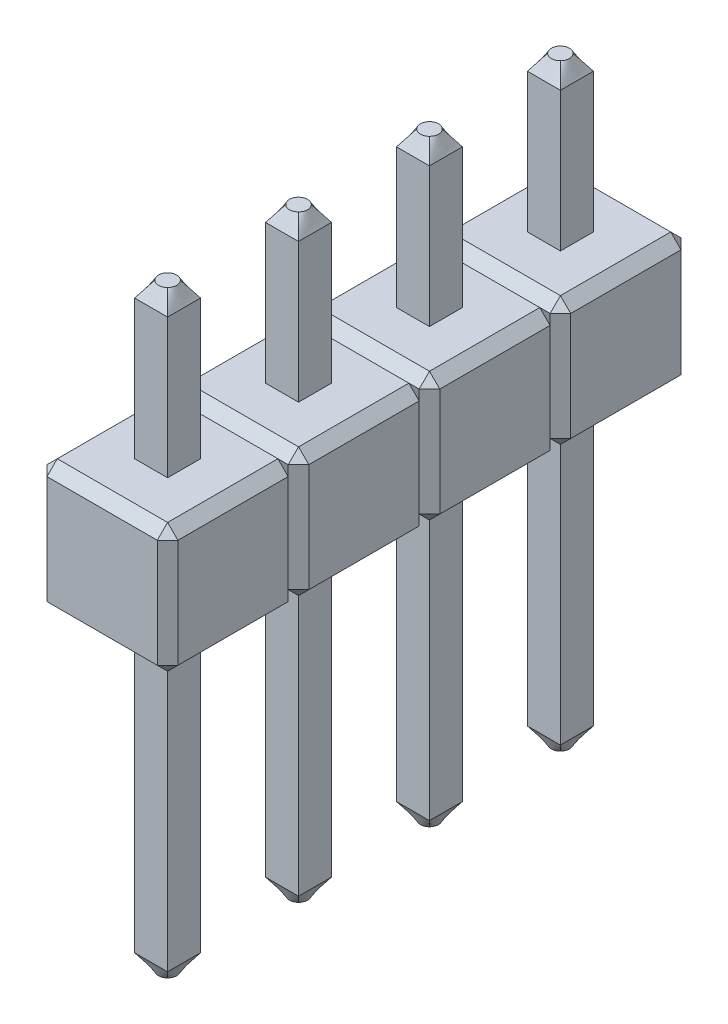
from build123d import *

# Parameters (mm, degrees)
PROFIL_1_W                  = 0.64
PROFIL_1_H                  = 0.64
DODANIE_WYCI_GNI_CIE_DEPTH  = 5.5
SZYK_LINIOWY1_COUNT         = 4
SZYK_LINIOWY1_PITCH         = 2.54
SZKIC9_W                    = 2.54
SZKIC9_H                    = 2.54
SZKIC9_W_2                  = 0.64
SZKIC9_H_2                  = 0.64
DODANIE_WYCI_GNI_CIE1_DEPTH = 2.5
SFAZOWANIE2_SIZE            = 0.2
SZYK_LINIOWY2_COUNT         = 4
SZYK_LINIOWY2_PITCH         = 2.54


with BuildPart() as part:
    # Profil 1 → Dodanie-wyciągnięcie (new body)
    with BuildSketch(Plane(origin=(0, 0, 0), x_dir=(1, 0, 0), z_dir=(0, 1, 0))):
        Rectangle(PROFIL_1_W, PROFIL_1_H)
    dodanie_wyci_gni_cie = extrude(amount=DODANIE_WYCI_GNI_CIE_DEPTH)


with BuildPart() as body_2:
    # Wyciągnięcie po profilach: read off the stored shape, not the designer's step
    # Wyciągnięcie po profilach: loft between two sections, ruled curve by curve
    wyci_gni_cie_po_profilach_from = [
        Edge.make_bspline([(-0.32, 5.5, 0.32), (-0.213333333, 5.5, 0.32), (-0.106666667, 5.5, 0.32), (0.106666667, 5.5, 0.32), (0.213333333, 5.5, 0.32), (0.32, 5.5, 0.32)], [0, 0, 0, 0, 0.5, 0.5, 1, 1, 1, 1], 3),
        Edge.make_bspline([(0.32, 5.5, 0.32), (0.32, 5.5, 0.213333333), (0.32, 5.5, 0.106666667), (0.32, 5.5, -0.106666667), (0.32, 5.5, -0.213333333), (0.32, 5.5, -0.32)], [0, 0, 0, 0, 0.5, 0.5, 1, 1, 1, 1], 3),
        Edge.make_bspline([(-0.32, 5.5, -0.32), (-0.32, 5.5, -0.213333333), (-0.32, 5.5, -0.106666667), (-0.32, 5.5, 0.106666667), (-0.32, 5.5, 0.213333333), (-0.32, 5.5, 0.32)], [0, 0, 0, 0, 0.5, 0.5, 1, 1, 1, 1], 3),
        Edge.make_bspline([(0.32, 5.5, -0.32), (0.213333333, 5.5, -0.32), (0.106666667, 5.5, -0.32), (-0.106666667, 5.5, -0.32), (-0.213333333, 5.5, -0.32), (-0.32, 5.5, -0.32)], [0, 0, 0, 0, 0.5, 0.5, 1, 1, 1, 1], 3),
    ]
    wyci_gni_cie_po_profilach_to = [
        Edge.make_bspline([(-0.123743687, 5.8, 0.123743687), (-0.09457702, 5.8, 0.152910353), (-0.048324916, 5.8, 0.175), (0.048324916, 5.8, 0.175), (0.09457702, 5.8, 0.152910353), (0.123743687, 5.8, 0.123743687)], [0, 0, 0, 0, 0.5, 0.5, 1, 1, 1, 1], 3),
        Edge.make_bspline([(0.123743687, 5.8, 0.123743687), (0.152910353, 5.8, 0.09457702), (0.175, 5.8, 0.048324916), (0.175, 5.8, -0.048324916), (0.152910353, 5.8, -0.09457702), (0.123743687, 5.8, -0.123743687)], [0, 0, 0, 0, 0.5, 0.5, 1, 1, 1, 1], 3),
        Edge.make_bspline([(-0.123743687, 5.8, -0.123743687), (-0.152910353, 5.8, -0.09457702), (-0.175, 5.8, -0.048324916), (-0.175, 5.8, 0.048324916), (-0.152910353, 5.8, 0.09457702), (-0.123743687, 5.8, 0.123743687)], [0, 0, 0, 0, 0.5, 0.5, 1, 1, 1, 1], 3),
        Edge.make_bspline([(0.123743687, 5.8, -0.123743687), (0.09457702, 5.8, -0.152910353), (0.048324916, 5.8, -0.175), (-0.048324916, 5.8, -0.175), (-0.09457702, 5.8, -0.152910353), (-0.123743687, 5.8, -0.123743687)], [0, 0, 0, 0, 0.5, 0.5, 1, 1, 1, 1], 3),
    ]
    wyci_gni_cie_po_profilach = Solid(Shell([*[Face.make_surface_from_curves(wyci_gni_cie_po_profilach_from[k], wyci_gni_cie_po_profilach_to[k]) for k in range(4)], Face(Wire(wyci_gni_cie_po_profilach_from)), Face(Wire(wyci_gni_cie_po_profilach_to))]))
    add(wyci_gni_cie_po_profilach)


with BuildPart() as part_1:
    add(part.part)

    # Lustro4: Dodanie-wyciągnięcie, Wyciągnięcie po profilach across plane
    add(dodanie_wyci_gni_cie.mirror(Plane.ZX))
    add(wyci_gni_cie_po_profilach.mirror(Plane.ZX))


with BuildPart() as body_2_1:
    add(body_2.part)

    # Pin: union part
    add(part_1.part)


with BuildPart() as szyk_liniowy1_1:
    # Szyk liniowy1: pattern copy
    add(body_2_1.part.moved(Location(Vector(0, 0, 1) * (1 * SZYK_LINIOWY1_PITCH))))


with BuildPart() as szyk_liniowy1_2:
    # Szyk liniowy1: pattern copy
    add(body_2_1.part.moved(Location(Vector(0, 0, 1) * (2 * SZYK_LINIOWY1_PITCH))))


with BuildPart() as szyk_liniowy1_3:
    # Szyk liniowy1: pattern copy
    add(body_2_1.part.moved(Location(Vector(0, 0, 1) * (3 * SZYK_LINIOWY1_PITCH))))


with BuildPart() as body_5:
    # Szkic9 → Dodanie-wyciągnięcie1 (new body)
    with BuildSketch(Plane(origin=(0, 0.3, 0), x_dir=(1, 0, 0), z_dir=(0, 1, 0))):
        Rectangle(SZKIC9_W, SZKIC9_H)
        Rectangle(SZKIC9_W_2, SZKIC9_H_2, mode=Mode.SUBTRACT)
    extrude(amount=DODANIE_WYCI_GNI_CIE1_DEPTH)

    # Sfazowanie2
    sfazowanie2_edges = [body_5.edges().sort_by_distance(p)[0] for p in [
        (-1.27, 0.3, 0),
        (0, 0.3, -1.27),
        (1.27, 0.3, 0),
        (0, 0.3, 1.27),
        (-1.27, 1.55, 1.27),
        (-1.27, 1.55, -1.27),
        (1.27, 1.55, -1.27),
        (1.27, 1.55, 1.27),
        (0, 2.8, 1.27),
        (1.27, 2.8, 0),
        (0, 2.8, -1.27),
        (-1.27, 2.8, 0),
    ]]
    chamfer(sfazowanie2_edges, length=SFAZOWANIE2_SIZE)


with BuildPart() as szyk_liniowy2_1:
    # Szyk liniowy2: pattern copy
    add(body_5.part.moved(Location(Vector(0, 0, 1) * (1 * SZYK_LINIOWY2_PITCH))))


with BuildPart() as szyk_liniowy2_2:
    # Szyk liniowy2: pattern copy
    add(body_5.part.moved(Location(Vector(0, 0, 1) * (2 * SZYK_LINIOWY2_PITCH))))


with BuildPart() as szyk_liniowy2_3:
    # Szyk liniowy2: pattern copy
    add(body_5.part.moved(Location(Vector(0, 0, 1) * (3 * SZYK_LINIOWY2_PITCH))))


solid = Compound([body_2_1.part, szyk_liniowy1_1.part, szyk_liniowy1_2.part, szyk_liniowy1_3.part, body_5.part, szyk_liniowy2_1.part, szyk_liniowy2_2.part, szyk_liniowy2_3.part])
